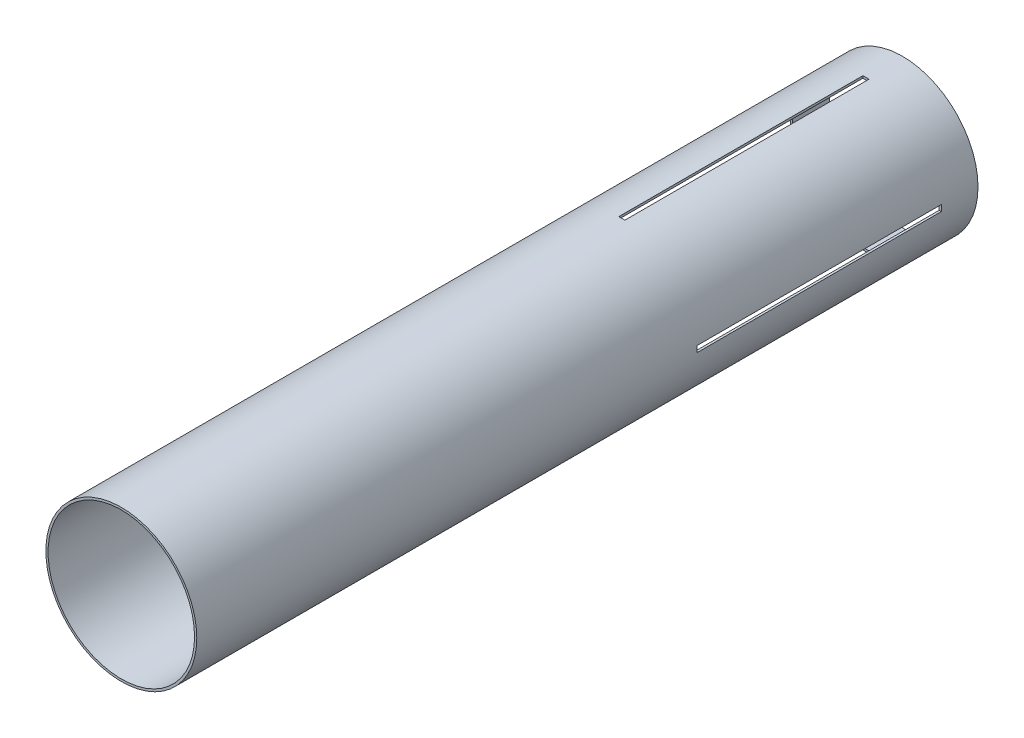
from build123d import *

# Parameters (mm, degrees)
SKETCH1_R           = 39.2557
SKETCH1_R_2         = 38.1
BOSS_EXTRUDE1_DEPTH = 203.2
SKETCH3_W           = 3.175
SKETCH3_H           = 127
CUT_EXTRUDE1_DEPTH  = 211.647240582
CIRPATTERN1_COUNT   = 4


with BuildPart() as part:
    # Sketch1 → Boss-Extrude1 (new, symmetric)
    with BuildSketch(Plane.XY):
        Circle(SKETCH1_R)
        Circle(SKETCH1_R_2, mode=Mode.SUBTRACT)
    extrude(amount=BOSS_EXTRUDE1_DEPTH, both=True)

    # Sketch3 → Cut-Extrude1 (cut, through all)
    with BuildSketch(Plane(origin=(0, 0, 0), x_dir=(1, 0, 0), z_dir=(0, 1, 0))):
        with Locations((0, 120.65)):
            Rectangle(SKETCH3_W, SKETCH3_H)
    cut_extrude1 = extrude(amount=CUT_EXTRUDE1_DEPTH, mode=Mode.SUBTRACT)

    # CirPattern1: Cut-Extrude1 ×4 about axis
    cirpattern1_axis = Axis((0, 0, 203.2), (0, 0, -1))
    for i in range(1, CIRPATTERN1_COUNT):
        add(cut_extrude1.rotate(cirpattern1_axis, i * 360 / CIRPATTERN1_COUNT), mode=Mode.SUBTRACT)


solid = part.part
